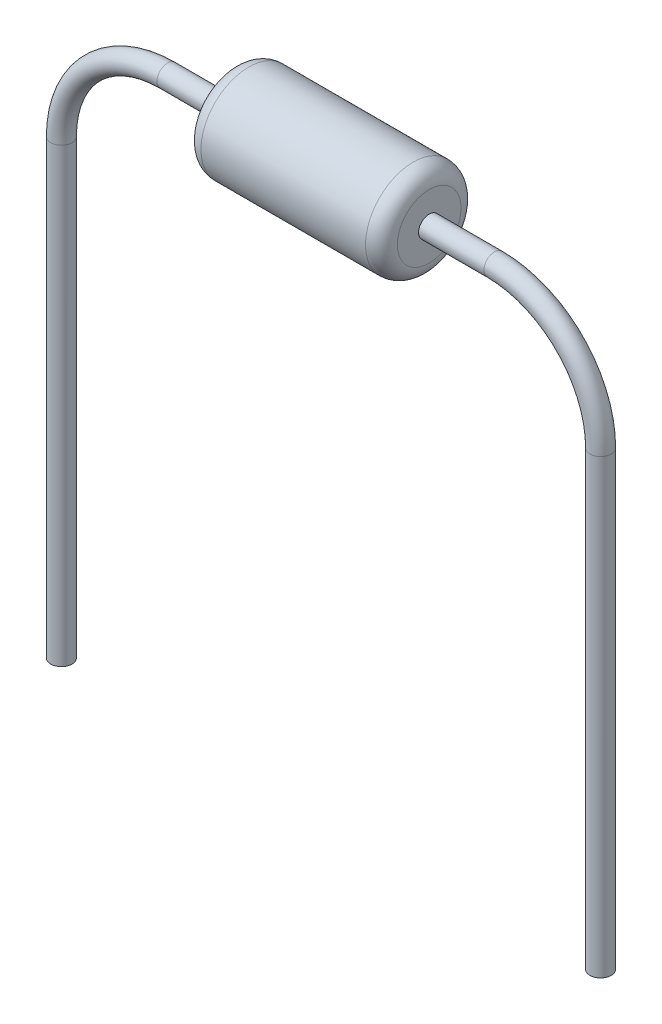
from build123d import *

# Parameters (mm, degrees)
SKETCH1_R           = 0.4
SKETCH1_R_2         = 0.2
BOSS_EXTRUDE1_DEPTH = 1.75
FILLET2_R           = 0.1
SKETCH4_R           = 0.9
SKETCH4_R_2         = 0.2
BOSS_EXTRUDE2_DEPTH = 1.85
FILLET1_R           = 0.3
SKETCH7_R           = 0.2
SKETCH9_R           = 0.05


with BuildPart() as part:
    # Sketch1 → Boss-Extrude1 (new, symmetric)
    with BuildSketch(Plane(origin=(0, 0, 0), x_dir=(0, 0, -1), z_dir=(1, 0, 0))):
        Circle(SKETCH1_R)
        Circle(SKETCH1_R_2, mode=Mode.SUBTRACT)
    extrude(amount=BOSS_EXTRUDE1_DEPTH, both=True)

    # Fillet2
    fillet2_edges = [part.edges().sort_by_distance(p)[0] for p in [
        (-1.75, 0, 0.4),
        (1.75, 0, 0.4),
    ]]
    fillet(fillet2_edges, radius=FILLET2_R)

    # Sketch9 → Cut-Revolve1 (revolve, cut)
    with BuildSketch(Plane.XY):
        with Locations((0, 0.4)):
            Circle(SKETCH9_R)
    revolve(axis=Axis((-1.65, 0, 0), (1, 0, 0)), mode=Mode.SUBTRACT)

    # Fillet3: read off the stored shape, not the designer's step
    # Fillet3 outline → Fillet3 (revolve, cut)
    with BuildSketch(Plane.YX):
        with BuildLine():
            ThreePointArc((0.4, 0.111803399), (0.391287093, 0.07097857), (0.366666667, 0.0372678))
            Line((0.366666667, 0.0372678), (0.4, 0.0372678))
            Line((0.4, 0.0372678), (0.4, 0.111803399))
        make_face()
        with BuildLine():
            Line((0.4, -0.0372678), (0.366666667, -0.0372678))
            ThreePointArc((0.366666667, -0.0372678), (0.391287093, -0.07097857), (0.4, -0.111803399))
            Line((0.4, -0.111803399), (0.4, -0.0372678))
        make_face()
    revolve(axis=Axis((0, 0, 0), (1, 0, 0)), mode=Mode.SUBTRACT)


with BuildPart() as body_2:
    # Sketch4 → Boss-Extrude2 (new, symmetric)
    with BuildSketch(Plane(origin=(0, 0, 0), x_dir=(0, 0, -1), z_dir=(1, 0, 0))):
        Circle(SKETCH4_R)
        Circle(SKETCH4_R_2, mode=Mode.SUBTRACT)
    extrude(amount=BOSS_EXTRUDE2_DEPTH, both=True)

    # Fillet1
    fillet1_edges = [body_2.edges().sort_by_distance(p)[0] for p in [
        (-1.85, 0, 0.9),
        (1.85, 0, 0.9),
    ]]
    fillet(fillet1_edges, radius=FILLET1_R)


with BuildPart() as body_3:
    # Sweep1: sweep along a path in Sketch6
    with BuildLine(Plane.XY) as sweep1_path:
        Line((-5.08, -10.508198559), (-5.08, -2))
        ThreePointArc((-5.08, -2), (-4.494213562, -0.585786438), (-3.08, 0))
        Line((-3.08, 0), (0, 0))
        Line((0, 0), (3.08, 0))
        ThreePointArc((3.08, 0), (4.494213562, -0.585786438), (5.08, -2))
        Line((5.08, -2), (5.08, -10.508198559))
    # Sketch7 → Sweep1 (sweep)
    with BuildSketch(Plane(origin=(0, 0, 0), x_dir=(0, 0, -1), z_dir=(1, 0, 0))):
        Circle(SKETCH7_R)
    sweep(path=sweep1_path.line)


with BuildPart() as body_4:
    # Sketch8 → Revolve2 (revolve)
    with BuildSketch(Plane.XY):
        with BuildLine():
            Line((-0.95, 0.42), (-0.95, 0.75))
            ThreePointArc((-0.95, 0.75), (-0.964644661, 0.785355339), (-1, 0.8))
            Line((-1, 0.8), (-1.55, 0.8))
            ThreePointArc((-1.55, 0.8), (-1.620710678, 0.770710678), (-1.65, 0.7))
            Line((-1.65, 0.7), (-1.65, 0.42))
            Line((-1.65, 0.42), (-0.95, 0.42))
        make_face()
    revolve(axis=Axis((-0.95, 0, 0), (-1, 0, 0)))


solid = Compound([part.part, body_2.part, body_3.part, body_4.part])
